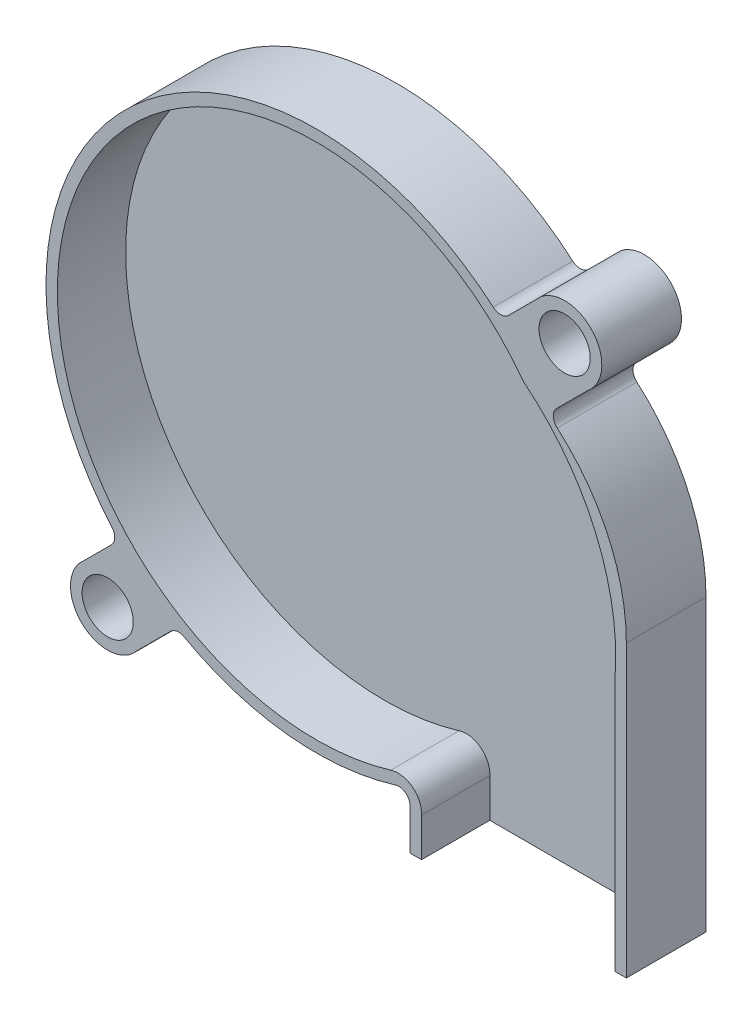
from build123d import *

# Parameters (mm, degrees)
BOSS_EXTRUDE1_DEPTH   = 7
FILLET1_R             = 1
FILLET2_R             = 1
FILLET3_R             = 1
CUT_EXTRUDE1_DEPTH    = 6
F_4_0MM_DOWEL_HOLE1_D = 4.5


with BuildPart() as part:
    # Sketch1 → Boss-Extrude1 (new body)
    with BuildSketch(Plane.XY):
        with BuildLine():
            Line((51, 0), (51, 25.5))
            ThreePointArc((51, 25.5), (49.182412553, 33.297587625), (44.104318796, 39.487818693))
            ThreePointArc((44.104318796, 39.487818693), (44.100505812, 39.494158329), (44.096690854, 39.500496777))
            Line((44.096690854, 39.500496777), (47.63222476, 43.036030683))
            ThreePointArc((47.63222476, 43.036030683), (48.118470522, 47.63222476), (43.522276444, 48.118470522))
            Line((43.522276444, 48.118470522), (39.986742538, 44.582936616))
            ThreePointArc((39.986742538, 44.582936616), (6.956213947, 44.043786053), (6.417063384, 11.013257462))
            Line((6.417063384, 11.013257462), (2.881529478, 7.477723556))
            ThreePointArc((2.881529478, 7.477723556), (3.36777524, 2.881529478), (7.963969317, 3.36777524))
            Line((7.963969317, 3.36777524), (11.499503223, 6.903309146))
            ThreePointArc((11.499503223, 6.903309146), (21.530362571, 3.603949385), (32, 4.978942549))
            Line((32, 4.978942549), (32, 0))
            Line((32, 0), (51, 0))
        make_face()
    extrude(amount=BOSS_EXTRUDE1_DEPTH)

    # Fillet1
    # the kernel refuses this fillet: 1 mm, written as the material it adds along each edge
    with BuildSketch(Plane(origin=(44.096690854, 39.500496777, 0), x_dir=(0.7715576110634285, -0.6361594554905989, 0), z_dir=(0, 0, 1))) as fillet1_piece_1:
        with BuildLine():
            CenterArc((1.100766551, 0.999676081), FILLET1_R, 174.506032256, 94.03559873)
            Line((0.105360267, 1.095417035), (0.005819639, 1.104991131))
            Line((0.005819639, 1.104991131), (-0.099540628, 0.009574095))
            Line((-0.099540628, 0.009574095), (-0.033285789, -0.0942977))
            ThreePointArc((-0.033285789, -0.0942977), (0.017424165, -0.104868941), (1.072770899, -0.099967608))
            Line((1.072770899, -0.099967608), (1.075315958, 0))
        make_face()
    extrude(amount=7)
    with BuildSketch(Plane(origin=(44.104318796, 39.487818693, 0), x_dir=(0.7745037653558564, -0.6325692985354254, 0), z_dir=(0, 0, 1))) as fillet1_piece_2:
        with BuildLine():
            CenterArc((1.091469777, 0.999547102), FILLET1_R, 174.23993613, 94.03559873)
            Line((0.096518871, 1.099909926), (-0.002976219, 1.109946208))
            ThreePointArc((-0.002976219, 1.109946208), (-0.113422726, 0.015030304), (-0.033782013, -0.094121069))
            Line((-0.033782013, -0.094121069), (0.003009305, -0.09995471))
            ThreePointArc((0.003009305, -0.09995471), (0.530688363, -0.092013175), (1.058367421, -0.09995471))
            Line((1.058367421, -0.09995471), (1.061376726, 0))
        make_face()
    extrude(amount=7)

    # Fillet2
    fillet2_edges = [part.edges().sort_by_distance(p)[0] for p in [
        (11.499503223, 6.903309146, 3.5),
        (6.417063384, 11.013257462, 3.5),
        (39.986742538, 44.582936616, 3.5),
    ]]
    fillet(fillet2_edges, radius=FILLET2_R)

    # Fillet3
    fillet3_edges = [part.edges().sort_by_distance(p)[0] for p in [
        (32, 4.978942549, 3.5),
    ]]
    fillet(fillet3_edges, radius=FILLET3_R)

    # Sketch2 → Cut-Extrude1 (cut)
    with BuildSketch(Plane.XY.offset(7)):
        with BuildLine():
            Line((33, 0), (33, 3.389836053))
            ThreePointArc((33, 3.389836053), (32.194148238, 5.146743671), (30.28668256, 5.459307466))
            ThreePointArc((30.28668256, 5.459307466), (2.151192178, 34.39520823), (41.992282379, 40.84344083))
            ThreePointArc((41.992282379, 40.84344083), (48.304075384, 32.522702207), (50, 22.217496636))
            Line((50, 22.217496636), (50, 0))
            Line((50, 0), (33, 0))
        make_face()
    extrude(amount=-CUT_EXTRUDE1_DEPTH, mode=Mode.SUBTRACT)

    # Ø4.0mm Dowel Hole1 (through all)
    with Locations(Plane(origin=(0, 0, 0), x_dir=(-1, 0, 0), z_dir=(0, 0, -1))):
        with Locations((-5.422749398, 5.422749398), (-45.577250602, 45.577250602)):
            Hole(F_4_0MM_DOWEL_HOLE1_D / 2)


solid = part.part
